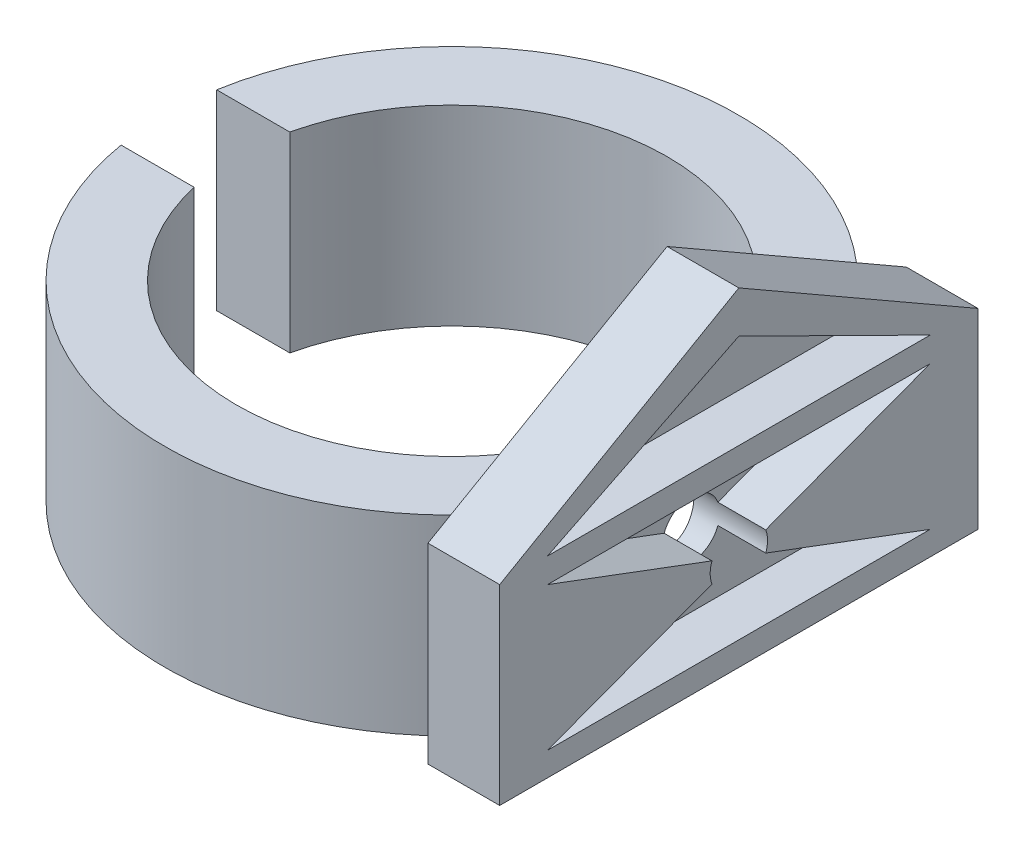
from build123d import *

# Parameters (mm, degrees)
SKETCH1_R           = 30
SKETCH1_R_2         = 22.5
BOSS_EXTRUDE1_DEPTH = 20
SKETCH2_W           = 50
SKETCH2_H           = 20
BOSS_EXTRUDE2_DEPTH = 7.5
SKETCH4_W           = 14.39860727
SKETCH4_H           = 10
CUT_EXTRUDE1_DEPTH  = 20
CUT_EXTRUDE3_DEPTH  = 5
SKETCH8_R           = 3
CUT_EXTRUDE4_DEPTH  = 10
BOSS_EXTRUDE3_DEPTH = 7.5
CUT_EXTRUDE5_DEPTH  = 5


with BuildPart() as part:
    # Sketch1 → Boss-Extrude1 (new body)
    with BuildSketch(Plane(origin=(0, 0, 0), x_dir=(1, 0, 0), z_dir=(0, 1, 0))):
        Circle(SKETCH1_R)
        Circle(SKETCH1_R_2, mode=Mode.SUBTRACT)
    extrude(amount=BOSS_EXTRUDE1_DEPTH)

    # Sketch2 → Boss-Extrude2 (add)
    with BuildSketch(Plane(origin=(22.5, 0, 0), x_dir=(0, 0, -1), z_dir=(1, 0, 0))):
        with Locations((0, 10)):
            Rectangle(SKETCH2_W, SKETCH2_H)
    extrude(amount=BOSS_EXTRUDE2_DEPTH)

    # Sketch4 → Cut-Extrude1 (cut)
    with BuildSketch(Plane(origin=(0, 0, 0), x_dir=(1, 0, 0), z_dir=(0, 1, 0))):
        with Locations((-26.790895642, 0)):
            Rectangle(SKETCH4_W, SKETCH4_H)
    extrude(amount=CUT_EXTRUDE1_DEPTH, mode=Mode.SUBTRACT)

    # Sketch7 → Cut-Extrude3 (cut)
    with BuildSketch(Plane(origin=(30, 0, 0), x_dir=(0, 0, -1), z_dir=(1, 0, 0))):
        Polygon((-1, 9.625), (-20, 2.5), (20, 2.5), (1, 9.625), (1, 10.375), (20, 17.5), (-20, 17.5), (-1, 10.375), align=None)
    extrude(amount=-CUT_EXTRUDE3_DEPTH, mode=Mode.SUBTRACT)

    # Sketch8 → Cut-Extrude4 (cut)
    with BuildSketch(Plane(origin=(30, 0, 0), x_dir=(0, 0, -1), z_dir=(1, 0, 0))):
        with Locations((0, 10)):
            Circle(SKETCH8_R)
    extrude(amount=-CUT_EXTRUDE4_DEPTH, mode=Mode.SUBTRACT)

    # Sketch9 → Boss-Extrude3 (add)
    with BuildSketch(Plane(origin=(30, 0, 0), x_dir=(0, 0, -1), z_dir=(1, 0, 0))):
        Polygon((-25, 20), (0, 34.357764991), (25, 20), align=None)
    extrude(amount=-BOSS_EXTRUDE3_DEPTH)

    # Sketch10 → Cut-Extrude5 (cut)
    with BuildSketch(Plane(origin=(30, 0, 0), x_dir=(0, 0, -1), z_dir=(1, 0, 0))):
        Polygon((-20, 20.088403301), (20, 20.088403301), (0, 29.990964176), align=None)
    extrude(amount=-CUT_EXTRUDE5_DEPTH, mode=Mode.SUBTRACT)


solid = part.part
